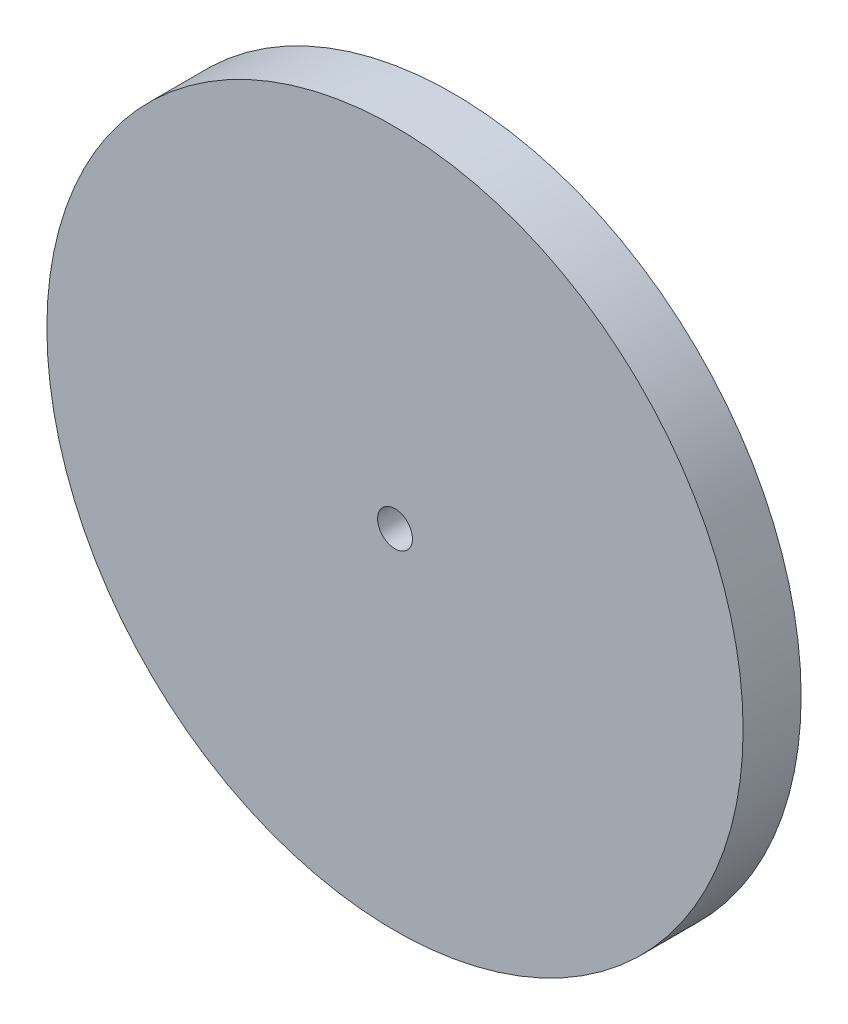
from build123d import *

# Parameters (mm, degrees)
SKETCH1_R           = 30
SKETCH1_R_2         = 1.5
BOSS_EXTRUDE1_DEPTH = 5


with BuildPart() as part:
    # Sketch1 → Boss-Extrude1 (new body)
    with BuildSketch(Plane.XY):
        Circle(SKETCH1_R)
        Circle(SKETCH1_R_2, mode=Mode.SUBTRACT)
    extrude(amount=BOSS_EXTRUDE1_DEPTH)


solid = part.part
